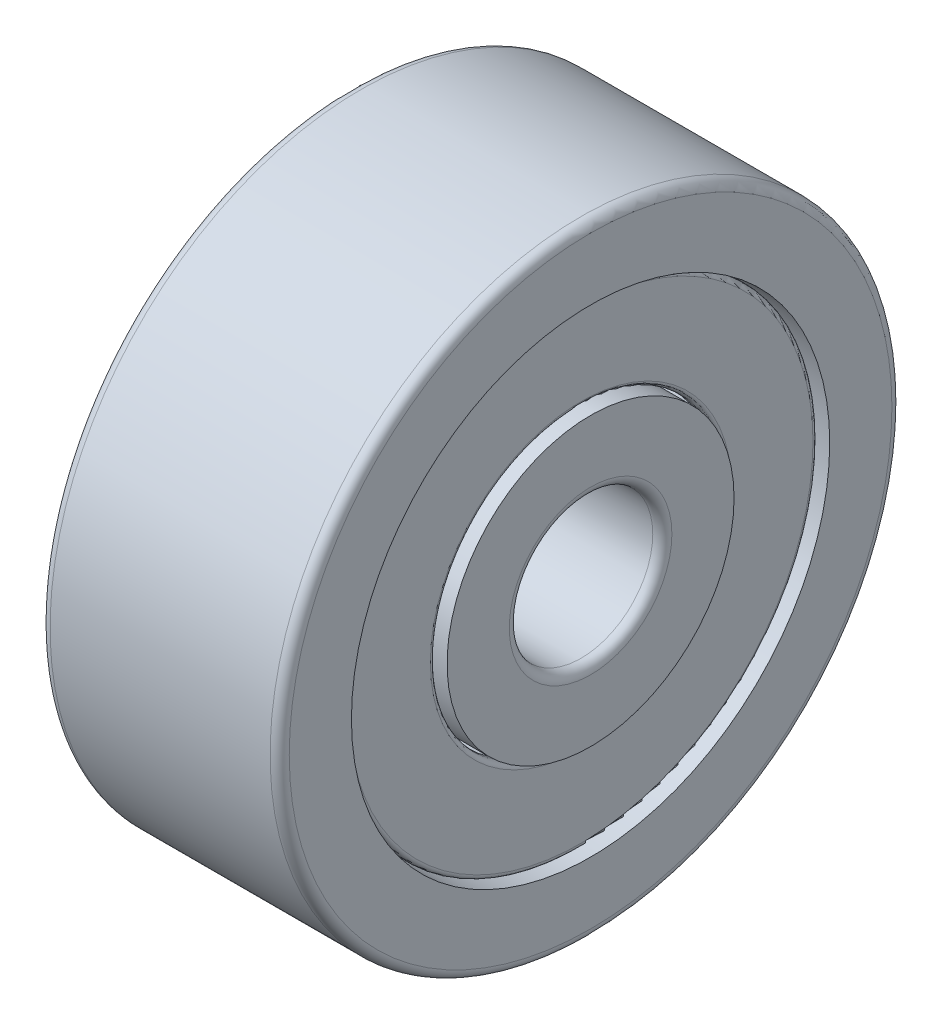
from build123d import *

# Parameters (mm, degrees)
CAGSPISKE_W         = 0.3
CAGSPISKE_H         = 0.5
CAGESPINE_ANGLE     = 0.001
BALLSDETAILED_COUNT = 8
BALLSDETAILED_ANGLE = 315
BOSS_EXTRU_1_START  = -0.2
ESQUISSE1_R         = 4.95
ESQUISSE1_R_2       = 3.05
BOSS_EXTRU_1_DEPTH  = 0.2
CONG_1_R            = 0.1


with BuildPart() as part:
    # CagSpiSke → CageSpine (revolve)
    with BuildSketch(Plane.XY):
        with Locations((0, 4)):
            Rectangle(CAGSPISKE_W, CAGSPISKE_H)
    revolve(axis=Axis((-20.6375, 0, 0), (-1, 0, 0)), revolution_arc=CAGESPINE_ANGLE)

    # BalDetSke → BallDetailed (revolve)
    with BuildSketch(Plane.XY):
        with BuildLine():
            Line((-1.5, 4), (1.5, 4))
            ThreePointArc((1.5, 4), (0, 2.5), (-1.5, 4))
        make_face()
    balldetailed = revolve(axis=Axis((-1.905, 4, 0), (1, 0, 0)))

    # InnRacSke → InnerRace (revolve)
    with BuildSketch(Plane.XY):
        with BuildLine():
            Line((-1.084262422, 3), (-2.5, 3))
            Line((-2.5, 3), (-2.5, 1.7))
            ThreePointArc((-2.5, 1.7), (-2.441421356, 1.558578644), (-2.3, 1.5))
            Line((-2.3, 1.5), (2.3, 1.5))
            ThreePointArc((2.3, 1.5), (2.441421356, 1.558578644), (2.5, 1.7))
            Line((2.5, 1.7), (2.5, 3))
            Line((2.5, 3), (1.084262422, 3))
            ThreePointArc((1.084262422, 3), (0, 2.525), (-1.084262422, 3))
        make_face()
    revolve(axis=Axis((-20.6375, 0, 0), (1, 0, 0)))

    # OutRacSke → OuterRace (revolve)
    with BuildSketch(Plane.XY):
        with BuildLine():
            Line((-1.084262422, 5), (-2.5, 5))
            Line((-2.5, 5), (-2.5, 6.3))
            ThreePointArc((-2.5, 6.3), (-2.441421356, 6.441421356), (-2.3, 6.5))
            Line((-2.3, 6.5), (2.3, 6.5))
            ThreePointArc((2.3, 6.5), (2.441421356, 6.441421356), (2.5, 6.3))
            Line((2.5, 6.3), (2.5, 5))
            Line((2.5, 5), (1.084262422, 5))
            ThreePointArc((1.084262422, 5), (0, 5.475), (-1.084262422, 5))
        make_face()
    revolve(axis=Axis((-20.6375, 0, 0), (1, 0, 0)))

    # BallsDetailed: BallDetailed ×8 about axis
    ballsdetailed_axis = Axis((-50, 0, 0), (1, 0, 0))
    for i in range(1, BALLSDETAILED_COUNT):
        add(balldetailed.rotate(ballsdetailed_axis, i * BALLSDETAILED_ANGLE / (BALLSDETAILED_COUNT - 1)))


with BuildPart() as body_2:
    # Esquisse1 → Boss.-Extru.1 (new body)
    with BuildSketch(Plane(origin=(2.5, 0, 0), x_dir=(0, 0, -1), z_dir=(1, 0, 0)).offset(BOSS_EXTRU_1_START)):
        Circle(ESQUISSE1_R)
        Circle(ESQUISSE1_R_2, mode=Mode.SUBTRACT)
    extrude(amount=-BOSS_EXTRU_1_DEPTH)

    # Congé1
    cong_1_edges = [body_2.edges().sort_by_distance(p)[0] for p in [
        (2.3, 0, 4.95),
        (2.3, 0, 3.05),
    ]]
    fillet(cong_1_edges, radius=CONG_1_R)


with BuildPart() as body_3:
    # Symétrie2: mirrored copy
    add(body_2.part.mirror(Plane(origin=(0, 0, 0), x_dir=(0, 0, 1), z_dir=(1, 0, 0))))


solid = Compound([part.part, body_2.part, body_3.part])
